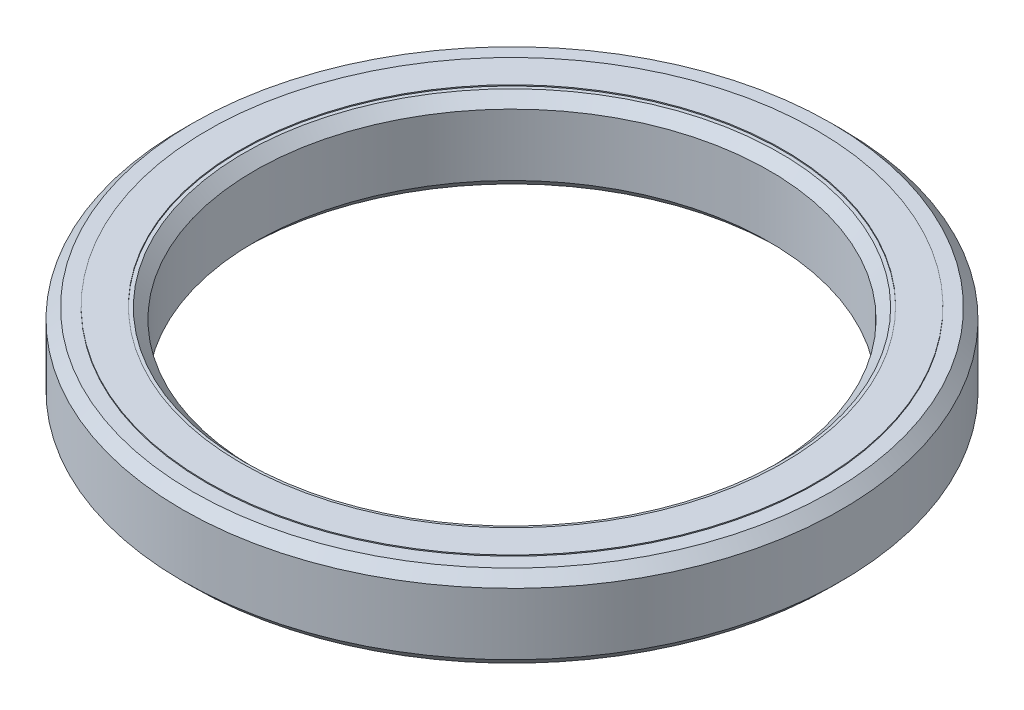
from build123d import *

# Parameters (mm, degrees)
CROQUIS1_R              = 16
CROQUIS1_R_2            = 12.5
SALIENTE_EXTRUIR1_DEPTH = 2
CHAFL_N1_SIZE           = 0.5
CROQUIS2_R              = 14.793460403
CROQUIS2_R_2            = 13.169701353
SALIENTE_EXTRUIR2_DEPTH = 2.05


with BuildPart() as part:
    # Croquis1 → Saliente-Extruir1 (new, symmetric)
    with BuildSketch(Plane(origin=(0, 0, 0), x_dir=(1, 0, 0), z_dir=(0, 1, 0))):
        Circle(CROQUIS1_R)
        Circle(CROQUIS1_R_2, mode=Mode.SUBTRACT)
    extrude(amount=SALIENTE_EXTRUIR1_DEPTH, both=True)

    # Chaflán1
    chafl_n1_edges = [part.edges().sort_by_distance(p)[0] for p in [
        (-12.5, -2, 0),
        (-12.5, 2, 0),
        (-16, -2, 0),
        (-16, 2, 0),
    ]]
    chamfer(chafl_n1_edges, length=CHAFL_N1_SIZE)

    # Croquis2 → Saliente-Extruir2 (add, symmetric)
    with BuildSketch(Plane(origin=(0, 0, 0), x_dir=(1, 0, 0), z_dir=(0, 1, 0))):
        Circle(CROQUIS2_R)
        Circle(CROQUIS2_R_2, mode=Mode.SUBTRACT)
    extrude(amount=SALIENTE_EXTRUIR2_DEPTH, both=True)


solid = part.part
